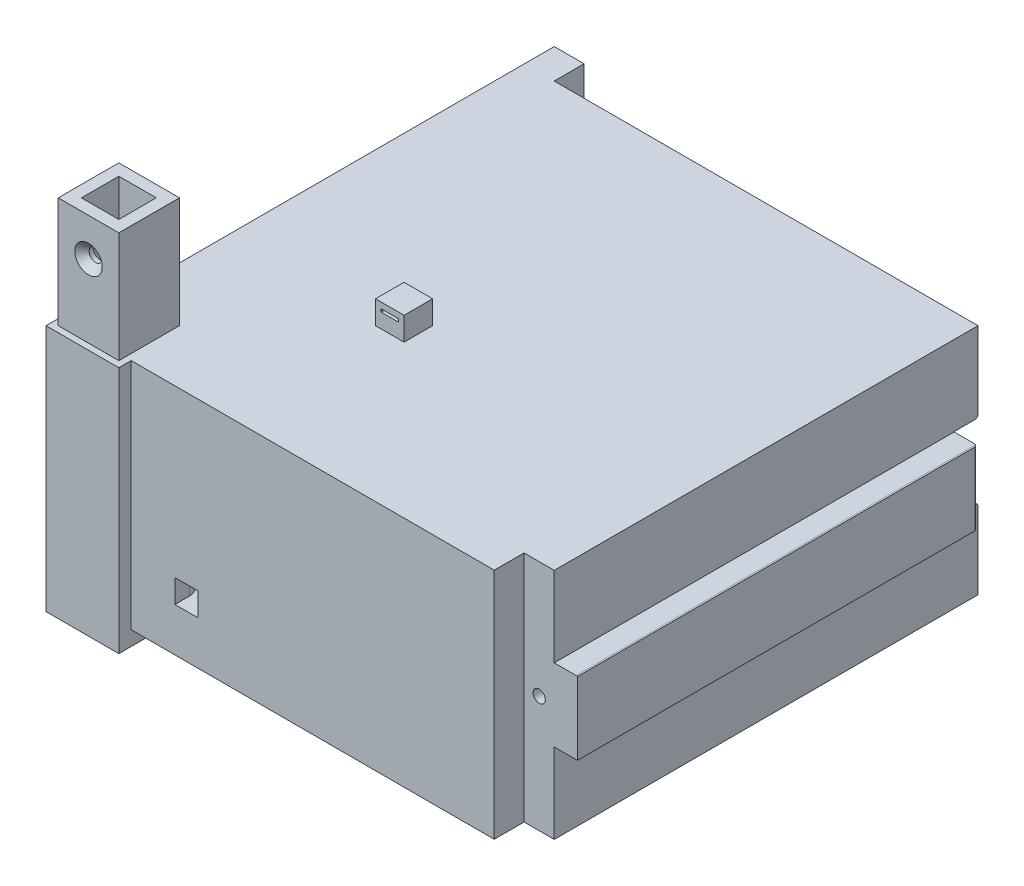
from build123d import *

# Parameters (mm, degrees)
SKETCH1_W                                           = 155.7
SKETCH1_H                                           = 155.7
BOSS_EXTRUDE2_DEPTH                                 = 80
SKETCH3_W                                           = 8
SKETCH3_H                                           = 25
BOSS_EXTRUDE4_DEPTH                                 = 145.45
CHAMFER1_SIZE                                       = 0.508
CHAMFER1_SIZE2                                      = 0.03552282
CHAMFER2_SIZE                                       = 0.508
CHAMFER2_SIZE2                                      = 0.03552282
SKETCH4_W                                           = 8.2
SKETCH4_H                                           = 25.2
CUT_EXTRUDE6_DEPTH                                  = 160.2
FILLET1_R                                           = 1
SKETCH6_W                                           = 10.35
SKETCH6_H                                           = 10.25
CUT_EXTRUDE7_DEPTH                                  = 80
SKETCH7_W                                           = 10.25
SKETCH7_H                                           = 10.25
BOSS_EXTRUDE5_DEPTH                                 = 80
CSK_FOR_M3_COUNTERSUNK_FLAT_HEAD_SCREW1_D           = 3.4
CSK_FOR_M3_COUNTERSUNK_FLAT_HEAD_SCREW1_DEPTH       = 16
CSK_FOR_M3_COUNTERSUNK_FLAT_HEAD_SCREW1_CSINK_D     = 6.3
CSK_FOR_M3_COUNTERSUNK_FLAT_HEAD_SCREW1_CSINK_ANGLE = 90
CSK_FOR_M3_COUNTERSUNK_FLAT_HEAD_SCREW1_TIP         = 1.021463052
SKETCH12_R                                          = 2.1
CUT_EXTRUDE9_DEPTH                                  = 5
FILLET2_START                                       = -18.821212121
FILLET2_DEPTH                                       = 152.821212121
FILLET3_START                                       = -18.821212121
FILLET3_DEPTH                                       = 152.821212121
SKETCH14_W                                          = 9.8
SKETCH14_H                                          = 9.8
BOSS_EXTRUDE6_DEPTH                                 = 8
CUT_EXTRUDE12_START                                 = -9.8
SKETCH17_W                                          = 6
SKETCH17_H                                          = 1
CUT_EXTRUDE12_DEPTH                                 = 1
CUT_EXTRUDE13_START                                 = -9.8
SKETCH19_W                                          = 6
SKETCH19_H                                          = 1
CUT_EXTRUDE13_DEPTH                                 = 1
BOSS_EXTRUDE7_DEPTH                                 = 5
BOSS_EXTRUDE7_DEPTH_BACK                            = 80
SKETCH20_W                                          = 25
SKETCH20_H                                          = 25
SKETCH21_W                                          = 20.8
SKETCH21_H                                          = 20.8
BOSS_EXTRUDE8_DEPTH                                 = 38
SKETCH23_W                                          = 12.85
SKETCH23_H                                          = 12.85
CUT_EXTRUDE14_DEPTH                                 = 110
CSK_FOR_M4_COUNTERSUNK_FLAT_HEAD_SCREW1_D           = 4.5
CSK_FOR_M4_COUNTERSUNK_FLAT_HEAD_SCREW1_DEPTH       = 26
CSK_FOR_M4_COUNTERSUNK_FLAT_HEAD_SCREW1_CSINK_D     = 9.4
CSK_FOR_M4_COUNTERSUNK_FLAT_HEAD_SCREW1_CSINK_ANGLE = 90
CSK_FOR_M4_COUNTERSUNK_FLAT_HEAD_SCREW1_TIP         = 1.351936393
SKETCH27_W                                          = 8
SKETCH27_H                                          = 8
CUT_EXTRUDE15_DEPTH                                 = 20
SKETCH28_W                                          = 10
SKETCH28_H                                          = 8
CUT_EXTRUDE16_DEPTH                                 = 33.925
FILLET4_R                                           = 5
FILLET5_R                                           = 3


with BuildPart() as part:
    # Sketch1 → Boss-Extrude2 (new body)
    with BuildSketch(Plane(origin=(0, 0, 0), x_dir=(1, 0, 0), z_dir=(0, 1, 0))):
        with Locations((55.528787879, -61.975)):
            Rectangle(SKETCH1_W, SKETCH1_H)
    extrude(amount=BOSS_EXTRUDE2_DEPTH)

    # Sketch3 → Boss-Extrude4 (add)
    with BuildSketch(Plane.XY.offset(-15.875)):
        with Locations((137.378787879, 40)):
            Rectangle(SKETCH3_W, SKETCH3_H)
    extrude(amount=BOSS_EXTRUDE4_DEPTH)

    # Chamfer1
    chamfer1_edges = [part.edges().sort_by_distance(p)[0] for p in [
        (141.378787879, 52.5, 56.85),
    ]]
    chamfer1_side = [part.faces().sort_by_distance(p)[0] for p in [
        (137.378787879, 52.5, 56.85),
    ]]
    chamfer(chamfer1_edges, length=CHAMFER1_SIZE, length2=CHAMFER1_SIZE2, reference=chamfer1_side[0])

    # Chamfer2
    chamfer2_edges = [part.edges().sort_by_distance(p)[0] for p in [
        (141.378787879, 27.5, 56.85),
    ]]
    chamfer2_side = [part.faces().sort_by_distance(p)[0] for p in [
        (137.378787879, 27.5, 56.85),
    ]]
    chamfer(chamfer2_edges, length=CHAMFER2_SIZE, length2=CHAMFER2_SIZE2, reference=chamfer2_side[0])

    # Sketch4 → Cut-Extrude6 (cut)
    with BuildSketch(Plane.ZY.offset(-141.378787879)):
        with Locations((-11.775, 40)):
            Rectangle(SKETCH4_W, SKETCH4_H)
    extrude(amount=CUT_EXTRUDE6_DEPTH, mode=Mode.SUBTRACT)

    # Fillet1
    fillet1_edges = [part.edges().sort_by_distance(p)[0] for p in [
        (141.378787879, 40, -7.675),
    ]]
    fillet(fillet1_edges, radius=FILLET1_R)

    # Sketch6 → Cut-Extrude7 (cut)
    with BuildSketch(Plane(origin=(0, 80, 0), x_dir=(1, 0, 0), z_dir=(0, 1, 0))):
        with Locations((128.203787879, -134.7)):
            Rectangle(SKETCH6_W, SKETCH6_H)
    extrude(amount=-CUT_EXTRUDE7_DEPTH, mode=Mode.SUBTRACT)

    # Sketch7 → Boss-Extrude5 (add)
    with BuildSketch(Plane(origin=(0, 80, 0), x_dir=(1, 0, 0), z_dir=(0, 1, 0))):
        with Locations((-17.196212121, 21)):
            Rectangle(SKETCH7_W, SKETCH7_H)
    extrude(amount=-BOSS_EXTRUDE5_DEPTH)

    # CSK for M3 Countersunk Flat Head Screw1
    with Locations(Plane.ZY.offset(22.321212121)):
        with Locations((-21, 40)):
            CounterSinkHole(CSK_FOR_M3_COUNTERSUNK_FLAT_HEAD_SCREW1_D / 2, CSK_FOR_M3_COUNTERSUNK_FLAT_HEAD_SCREW1_CSINK_D / 2, depth=CSK_FOR_M3_COUNTERSUNK_FLAT_HEAD_SCREW1_DEPTH, counter_sink_angle=CSK_FOR_M3_COUNTERSUNK_FLAT_HEAD_SCREW1_CSINK_ANGLE)
            with Locations((0, 0, -(CSK_FOR_M3_COUNTERSUNK_FLAT_HEAD_SCREW1_DEPTH + CSK_FOR_M3_COUNTERSUNK_FLAT_HEAD_SCREW1_TIP / 2))):  # 118° drill point
                Cone(0, CSK_FOR_M3_COUNTERSUNK_FLAT_HEAD_SCREW1_D / 2, CSK_FOR_M3_COUNTERSUNK_FLAT_HEAD_SCREW1_TIP, mode=Mode.SUBTRACT)

    # Sketch12 → Cut-Extrude9 (cut)
    with BuildSketch(Plane.XY.offset(129.575)):
        with Locations((128.203787879, 40)):
            Circle(SKETCH12_R)
    extrude(amount=-CUT_EXTRUDE9_DEPTH, mode=Mode.SUBTRACT)

    # Fillet2: read off the stored shape, not the designer's step
    # Fillet2 outline → Fillet2 (cut)
    with BuildSketch(Plane.YZ.offset(FILLET2_START)):
        with BuildLine():
            Line((52.6, -15.875), (53.6, -15.875))
            ThreePointArc((53.6, -15.875), (52.892893219, -15.582106781), (52.6, -14.875))
            Line((52.6, -14.875), (52.6, -15.875))
        make_face()
    extrude(amount=FILLET2_DEPTH, mode=Mode.SUBTRACT)

    # Fillet3: read off the stored shape, not the designer's step
    # Fillet3 outline → Fillet3 (cut)
    with BuildSketch(Plane.YZ.offset(FILLET3_START)):
        with BuildLine():
            ThreePointArc((27.4, -14.875), (27.107106781, -15.582106781), (26.4, -15.875))
            Line((26.4, -15.875), (27.4, -15.875))
            Line((27.4, -15.875), (27.4, -14.875))
        make_face()
    extrude(amount=FILLET3_DEPTH, mode=Mode.SUBTRACT)

    # Sketch14 → Boss-Extrude6 (add)
    with BuildSketch(Plane(origin=(0, 80, 0), x_dir=(1, 0, 0), z_dir=(0, 1, 0))):
        with Locations((34.878787879, -82.625)):
            Rectangle(SKETCH14_W, SKETCH14_H)
    extrude(amount=BOSS_EXTRUDE6_DEPTH)

    # Sketch17 → Cut-Extrude12 (cut)
    with BuildSketch(Plane(origin=(39.778787879, 0, 0), x_dir=(0, 0, -1), z_dir=(1, 0, 0)).offset(CUT_EXTRUDE12_START)):
        with Locations((-82.625, 85.5)):
            Rectangle(SKETCH17_W, SKETCH17_H)
    extrude(amount=CUT_EXTRUDE12_DEPTH, mode=Mode.SUBTRACT)

    # Sketch19 → Cut-Extrude13 (cut)
    with BuildSketch(Plane(origin=(0, 0, 77.725), x_dir=(-1, 0, 0), z_dir=(0, 0, -1)).offset(CUT_EXTRUDE13_START)):
        with Locations((-34.878787879, 85.5)):
            Rectangle(SKETCH19_W, SKETCH19_H)
    extrude(amount=CUT_EXTRUDE13_DEPTH, mode=Mode.SUBTRACT)

    # Sketch20 → Boss-Extrude7 (add, two sides: drawn at the far end of the back side and taken through both)
    with BuildSketch(Plane(origin=(0, 0, 0), x_dir=(-1, 0, 0), z_dir=(0, -1, 0)).offset(-BOSS_EXTRUDE7_DEPTH_BACK)):
        with Locations((14.071212121, -131.575)):
            Rectangle(SKETCH20_W, SKETCH20_H)
    extrude(amount=BOSS_EXTRUDE7_DEPTH + BOSS_EXTRUDE7_DEPTH_BACK)

    # Sketch21 → Boss-Extrude8 (add)
    with BuildSketch(Plane(origin=(0, 80, 0), x_dir=(1, 0, 0), z_dir=(0, 1, 0))):
        with Locations((-14.071212121, -131.575)):
            Rectangle(SKETCH21_W, SKETCH21_H)
    extrude(amount=BOSS_EXTRUDE8_DEPTH)

    # Sketch23 → Cut-Extrude14 (cut)
    with BuildSketch(Plane(origin=(0, 118, 0), x_dir=(1, 0, 0), z_dir=(0, 1, 0))):
        with Locations((-14.071212121, -131.575)):
            Rectangle(SKETCH23_W, SKETCH23_H)
    extrude(amount=-CUT_EXTRUDE14_DEPTH, mode=Mode.SUBTRACT)

    # CSK for M4 Countersunk Flat Head Screw1
    with Locations(Plane.XY.offset(141.975)):
        with Locations((-14.071212121, 105)):
            CounterSinkHole(CSK_FOR_M4_COUNTERSUNK_FLAT_HEAD_SCREW1_D / 2, CSK_FOR_M4_COUNTERSUNK_FLAT_HEAD_SCREW1_CSINK_D / 2, depth=CSK_FOR_M4_COUNTERSUNK_FLAT_HEAD_SCREW1_DEPTH, counter_sink_angle=CSK_FOR_M4_COUNTERSUNK_FLAT_HEAD_SCREW1_CSINK_ANGLE)
            with Locations((0, 0, -(CSK_FOR_M4_COUNTERSUNK_FLAT_HEAD_SCREW1_DEPTH + CSK_FOR_M4_COUNTERSUNK_FLAT_HEAD_SCREW1_TIP / 2))):  # 118° drill point
                Cone(0, CSK_FOR_M4_COUNTERSUNK_FLAT_HEAD_SCREW1_D / 2, CSK_FOR_M4_COUNTERSUNK_FLAT_HEAD_SCREW1_TIP, mode=Mode.SUBTRACT)

    # Sketch27 → Cut-Extrude15 (cut)
    with BuildSketch(Plane.XY.offset(139.825)):
        with Locations((17.428787879, 19)):
            Rectangle(SKETCH27_W, SKETCH27_H)
    extrude(amount=-CUT_EXTRUDE15_DEPTH, mode=Mode.SUBTRACT)

    # Sketch28 → Cut-Extrude16 (cut)
    with BuildSketch(Plane(origin=(13.428787879, 0, 0), x_dir=(0, 0, -1), z_dir=(1, 0, 0))):
        with Locations((-124.825, 19)):
            Rectangle(SKETCH28_W, SKETCH28_H)
    extrude(amount=-CUT_EXTRUDE16_DEPTH, mode=Mode.SUBTRACT)

    # Fillet4
    fillet4_edges = [part.edges().sort_by_distance(p)[0] for p in [
        (13.428787879, 19, 129.825),
    ]]
    fillet(fillet4_edges, radius=FILLET4_R)

    # Fillet5
    fillet5_edges = [part.edges().sort_by_distance(p)[0] for p in [
        (-7.646212121, 19, 129.825),
    ]]
    fillet(fillet5_edges, radius=FILLET5_R)


solid = part.part
